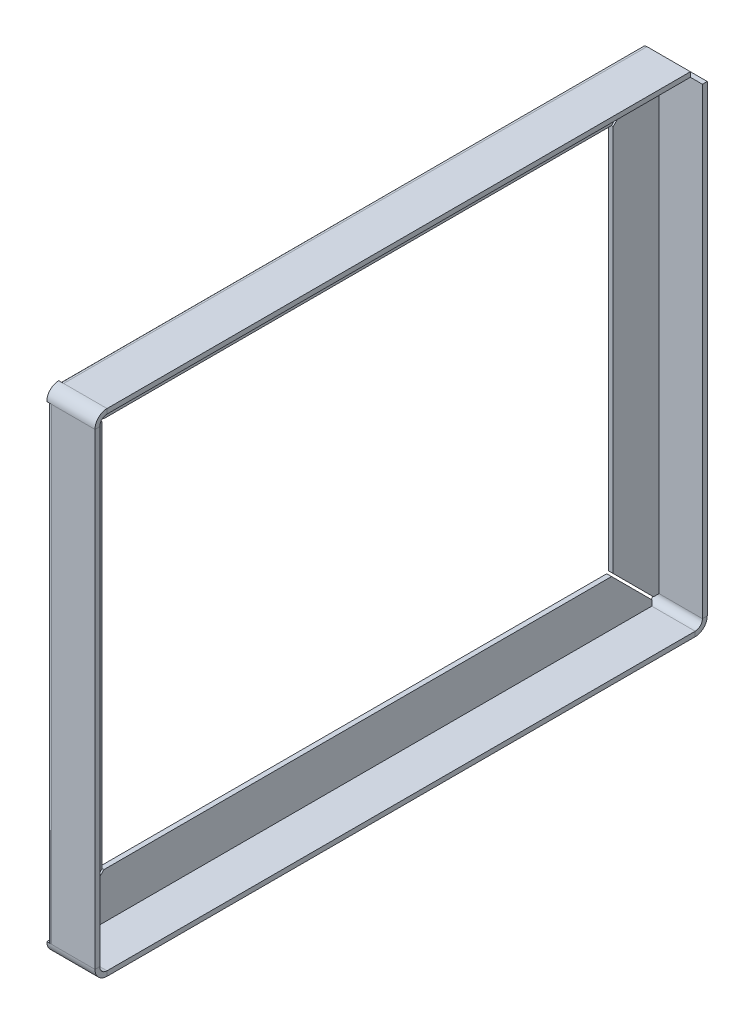
from build123d import *

# Parameters (mm, degrees)
BASE_FLANGE1_DEPTH       = 20
EDGE_FLANGE1_START       = -2
EDGE_FLANGE1_DEPTH       = 2
EDGE_FLANGE1_START_2     = -250
EDGE_FLANGE1_2_OUTLINE_W = 2
EDGE_FLANGE1_2_OUTLINE_H = 192
EDGE_FLANGE1_2_DEPTH     = 2.292893219
EDGE_FLANGE1_3_DEPTH     = 2
EDGE_FLANGE1_START_3     = -247
EDGE_FLANGE1_4_DEPTH     = 244
EDGE_FLANGE1_START_4     = 3
EDGE_FLANGE1_5_DEPTH     = 194


with BuildPart() as part:
    # Base-Flange1: sheet metal written as solids
    # Sketch1 → Base-Flange1 (new body)
    with BuildSketch(Plane(origin=(0, 0, 0), x_dir=(0, 0, -1), z_dir=(1, 0, 0))):
        with BuildLine():
            Line((245, 200), (3, 200))
            ThreePointArc((3, 200), (0.878679656, 199.121320344), (0, 197))
            Line((0, 197), (0, 3))
            ThreePointArc((0, 3), (0.878679656, 0.878679656), (3, 0))
            Line((3, 0), (247, 0))
            ThreePointArc((247, 0), (249.121320344, 0.878679656), (250, 3))
            Line((250, 3), (250, 195))
            Line((250, 195), (252, 195))
            Line((252, 195), (252, 3))
            ThreePointArc((252, 3), (250.535533906, -0.535533906), (247, -2))
            Line((247, -2), (3, -2))
            ThreePointArc((3, -2), (-0.535533906, -0.535533906), (-2, 3))
            Line((-2, 3), (-2, 197))
            ThreePointArc((-2, 197), (-0.535533906, 200.535533906), (3, 202))
            Line((3, 202), (245, 202))
            Line((245, 202), (245, 200))
        make_face()
    extrude(amount=BASE_FLANGE1_DEPTH)

    # Edge-Flange1: read off the stored shape, not the designer's step
    # Edge-Flange1 outline → Edge-Flange1 (add)
    with BuildSketch(Plane(origin=(0, 200, 0), x_dir=(0, 0, -1), z_dir=(-1, 0, 0)).offset(EDGE_FLANGE1_START)):
        Polygon((247, 197.707106781), (247, 200), (3, 200), (3, 197.707106781), (19.707106781, 181), (230.292893219, 181), align=None)
        Polygon((2.292893219, 197), (0, 197), (0, 3), (2.292893219, 3), (19, 19.707106781), (19, 180.292893219), align=None)
        Polygon((245, 0), (245, 4.292893219), (230.292893219, 19), (19.707106781, 19), (3, 2.292893219), (3, 0), align=None)
    extrude(amount=EDGE_FLANGE1_DEPTH)

    # Edge-Flange1 2 outline → Edge-Flange1 2 (add)
    with BuildSketch(Plane.XY.offset(EDGE_FLANGE1_START_2)):
        with Locations((1, 99)):
            Rectangle(EDGE_FLANGE1_2_OUTLINE_W, EDGE_FLANGE1_2_OUTLINE_H)
    extrude(amount=EDGE_FLANGE1_2_DEPTH)

    # Edge-Flange1 3 outline → Edge-Flange1 3 (add)
    with BuildSketch(Plane.YZ):
        Polygon((180.292893219, -231), (19.707106781, -231), (3, -247.707106781), (195, -247.707106781), (195, -245.707106781), align=None)
    extrude(amount=EDGE_FLANGE1_3_DEPTH)

    # Edge-Flange1 4 outline → Edge-Flange1 4 (cut)
    with BuildSketch(Plane.XY.offset(EDGE_FLANGE1_START_3)):
        with BuildLine():
            Line((0, -2), (2, -2))
            ThreePointArc((2, -2), (0.585786438, -1.414213562), (0, 0))
            Line((0, 0), (0, -2))
        make_face()
        with BuildLine():
            Line((0, 202), (0, 200))
            ThreePointArc((0, 200), (0.585786438, 201.414213562), (2, 202))
            Line((2, 202), (0, 202))
        make_face()
    extrude(amount=EDGE_FLANGE1_4_DEPTH, mode=Mode.SUBTRACT)

    # Edge-Flange1 5 outline → Edge-Flange1 5 (cut)
    with BuildSketch(Plane(origin=(0, 0, 0), x_dir=(1, 0, 0), z_dir=(0, 1, 0)).offset(EDGE_FLANGE1_START_4)):
        with BuildLine():
            Line((0, -2), (2, -2))
            ThreePointArc((2, -2), (0.585786438, -1.414213562), (0, 0))
            Line((0, 0), (0, -2))
        make_face()
        with BuildLine():
            Line((0, 252), (0, 250))
            ThreePointArc((0, 250), (0.585786438, 251.414213562), (2, 252))
            Line((2, 252), (0, 252))
        make_face()
    extrude(amount=EDGE_FLANGE1_5_DEPTH, mode=Mode.SUBTRACT)


solid = part.part
